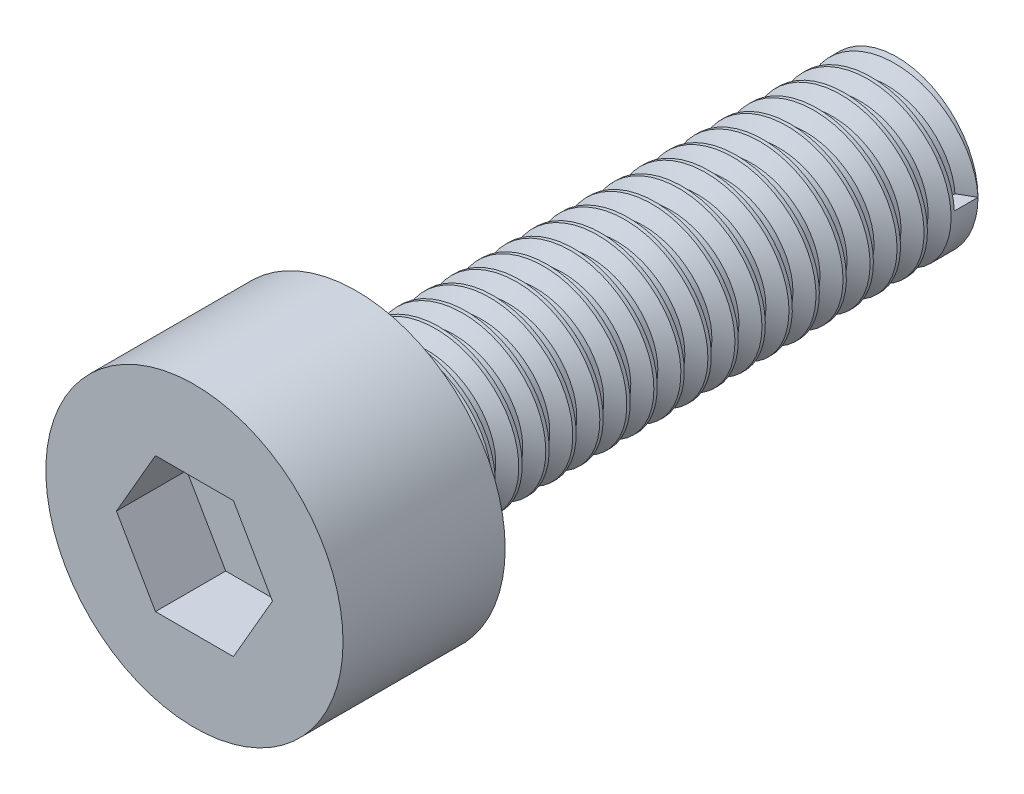
from build123d import *

# Parameters (mm, degrees)
SKETCH1_R              = 1.5
BOSS_EXTRUDE1_DEPTH    = 10
SKETCH2_R              = 2.75
BOSS_EXTRUDE2_DEPTH    = 3
CUT_EXTRUDE1_DEPTH     = 1.3
REN_NGOAI_M3X0_5_PITCH = 0.5


with BuildPart() as part:
    # Sketch1 → Boss-Extrude1 (new body)
    with BuildSketch(Plane.XY):
        Circle(SKETCH1_R)
    extrude(amount=-BOSS_EXTRUDE1_DEPTH)

    # Sketch2 → Boss-Extrude2 (add)
    with BuildSketch(Plane.XY):
        Circle(SKETCH2_R)
    extrude(amount=BOSS_EXTRUDE2_DEPTH)

    # Sketch3 → Cut-Extrude1 (cut)
    with BuildSketch(Plane.XY.offset(3)):
        Polygon((1.443375673, 0), (0.721687836, 1.25), (-0.721687836, 1.25), (-1.443375673, 0), (-0.721687836, -1.25), (0.721687836, -1.25), align=None)
    extrude(amount=-CUT_EXTRUDE1_DEPTH, mode=Mode.SUBTRACT)

    # Ren_ngoai_M3x0_5: the profile of Thread Profile1 profile screwed along a right-hand helix of 20 turns, 6 arcs to a turn; built about Z, then put on its axis
    ren_ngoai_m3x0_5_z = Axis((0, 0, 0), (0, 0, 1))
    ren_ngoai_m3x0_5_corners = [(1.5003, 0, -0.000173205), (1.5003, 0, 0.437673204), (1.229367063, 0, 0.281249999), (1.229367062, 0, 0.156249999)]
    with BuildLine(mode=Mode.PRIVATE) as ren_ngoai_m3x0_5_profile:
        Line(ren_ngoai_m3x0_5_corners[0], ren_ngoai_m3x0_5_corners[1])
        Line(ren_ngoai_m3x0_5_corners[1], ren_ngoai_m3x0_5_corners[2])
        Line(ren_ngoai_m3x0_5_corners[2], ren_ngoai_m3x0_5_corners[3])
        Line(ren_ngoai_m3x0_5_corners[3], ren_ngoai_m3x0_5_corners[0])
    ren_ngoai_m3x0_5_cap = Face(ren_ngoai_m3x0_5_profile.wire())
    ren_ngoai_m3x0_5_turn_angles = [0, 30, 60, 90, 120, 150, 180, 210, 240, 270, 300, 330, 360]
    ren_ngoai_m3x0_5_turn_weights = [1, 0.8660254037844387, 1, 0.8660254037844387, 1, 0.8660254037844387, 1, 0.8660254037844387, 1, 0.8660254037844387, 1, 0.8660254037844387, 1]
    ren_ngoai_m3x0_5_turn_rails = [Edge.make_bspline([Vector(p[0], p[1], 0).rotate(ren_ngoai_m3x0_5_z, ren_ngoai_m3x0_5_turn_angles[k]) / ren_ngoai_m3x0_5_turn_weights[k] + Vector(0, 0, p[2] + REN_NGOAI_M3X0_5_PITCH * ren_ngoai_m3x0_5_turn_angles[k] / 360) for k in range(13)], [0, 0, 0, 1, 1, 2, 2, 3, 3, 4, 4, 5, 5, 6, 6, 6], 2, ren_ngoai_m3x0_5_turn_weights) for p in ren_ngoai_m3x0_5_corners]
    ren_ngoai_m3x0_5_turn_sides = [Face.make_surface_from_curves(ren_ngoai_m3x0_5_turn_rails[p[0]], ren_ngoai_m3x0_5_turn_rails[p[1]]) for p in [(0, 1), (1, 2), (2, 3), (3, 0)]]
    ren_ngoai_m3x0_5 = Plane(origin=(0, 0, -10), x_dir=(1, 0, 0), z_dir=(0, 0, 1)) * Solid(Shell([*[p.moved(Location((0, 0, REN_NGOAI_M3X0_5_PITCH * i))) for i in range(20) for p in ren_ngoai_m3x0_5_turn_sides], ren_ngoai_m3x0_5_cap, ren_ngoai_m3x0_5_cap.rotate(ren_ngoai_m3x0_5_z, 7200).moved(Location((0, 0, REN_NGOAI_M3X0_5_PITCH * 7200 / 360)))]))
    add(ren_ngoai_m3x0_5, mode=Mode.SUBTRACT)


solid = part.part
